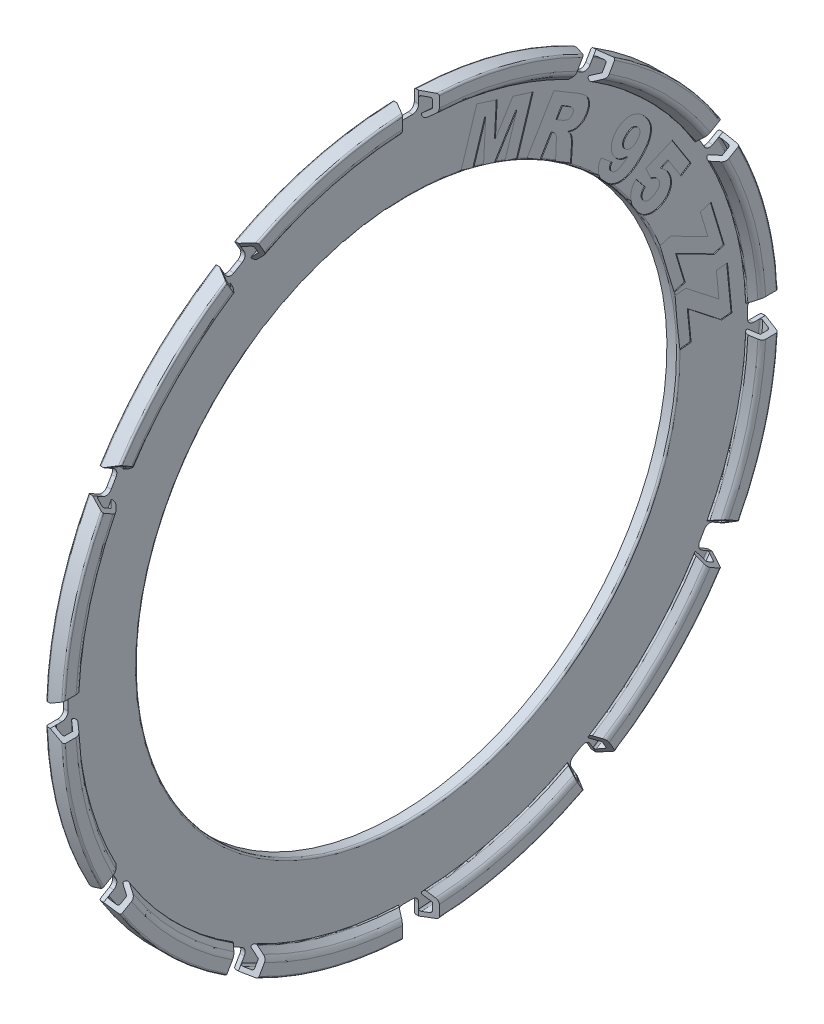
from build123d import *
from OCP.BRepFilletAPI import BRepFilletAPI_MakeFillet

# Parameters (mm, degrees)
FILLET1_R1         = 0.02
FILLET1_R2         = 0.08
SKETCH3_W          = 0.249361734
SKETCH3_H          = 0.345695775
CUT_EXTRUDE2_DEPTH = 6.800215655
CUT_EXTRUDE2_TAPER = -30
CUT_EXTRUDE3_REACH = 7.8
CIRPATTERN2_COUNT  = 12
CUT_EXTRUDE1_DEPTH = 0.01


with BuildPart() as part:
    # Sketch1 → Revolve1 (revolve)
    with BuildSketch(Plane.XY):
        Polygon((1.02, -3.15), (1.1, -3.15), (1.1, -4.1), (1.3, -4.1), (1.3, -3.92), (1.192753778, -3.830009735), (1.160614397, -3.868311957), (1.25, -3.943315383), (1.25, -4.05), (1.15, -4.05), (1.15, -3.1), (1.02, -3.1), align=None)
    revolve(axis=Axis((-6.429017492, 0, 0), (1, 0, 0)))

    # Fillet1: one fillet with a radius per group of edges: ONE call of the kernel's fillet builder (fillet() takes one radius for all edges)
    fillet1_edges_1 = [part.edges().sort_by_distance(p)[0] for p in [
        (1.192753778, 3.830009735, 0),
        (1.160614397, 3.868311957, 0),
        (1.15, 3.1, 0),
        (1.3, 4.1, 0),
        (1.1, 4.1, 0),
        (1.15, 4.05, 0),
        (1.25, 4.05, 0),
    ]]
    fillet1_edges_2 = [part.edges().sort_by_distance(p)[0] for p in [
        (1.3, 3.92, 0),
    ]]
    fillet1 = BRepFilletAPI_MakeFillet(part.part.solid().wrapped)
    for e in fillet1_edges_1:
        fillet1.Add(FILLET1_R1, e.wrapped)
    for e in fillet1_edges_2:
        fillet1.Add(FILLET1_R2, e.wrapped)
    add(Compound.cast(fillet1.Shape()), mode=Mode.REPLACE)

    # Sketch3 → Cut-Extrude2 (cut, through all)
    with BuildSketch(Plane(origin=(1.15, 0, 0), x_dir=(0, 0, -1), z_dir=(1, 0, 0))):
        with Locations((0, 3.957248854)):
            Rectangle(SKETCH3_W, SKETCH3_H)
    cut_extrude2 = extrude(amount=CUT_EXTRUDE2_DEPTH, taper=CUT_EXTRUDE2_TAPER, mode=Mode.SUBTRACT)

    # Cut-Extrude3: up to this face of the body (flat: up to its plane)
    cut_extrude3_end = Plane(part.part.faces().sort_by_distance((1.1, 3.964600173, 0))[0])
    # Sketch4 → Cut-Extrude3 (cut, up to the picked face)
    with BuildSketch(Plane(origin=(1.15, 0, 0), x_dir=(0, 0, -1), z_dir=(1, 0, 0)), mode=Mode.PRIVATE) as cut_extrude3_sk1:
        with BuildLine():
            Line((-0.124680867, 4.098103791), (-0.124680867, 3.96268108))
            ThreePointArc((-0.124680867, 3.96268108), (-0.104178342, 3.913183605), (-0.054680867, 3.89268108))
            Line((-0.054680867, 3.89268108), (0.054680867, 3.89268108))
            ThreePointArc((0.054680867, 3.89268108), (0.104178342, 3.913183605), (0.124680867, 3.96268108))
            Line((0.124680867, 3.96268108), (0.124680867, 4.098103791))
            ThreePointArc((0.124680867, 4.098103791), (0, 4.1), (-0.124680867, 4.098103791))
        make_face()
    cut_extrude3_tool1 = split(extrude(cut_extrude3_sk1.sketch, amount=-CUT_EXTRUDE3_REACH, mode=Mode.PRIVATE), bisect_by=cut_extrude3_end, keep=Keep.BOTH, mode=Mode.PRIVATE)
    cut_extrude3 = cut_extrude3_tool1.solids().sort_by(Axis((1.15, 3.999757, 0), (-1, 0, 0)))[0]
    add(cut_extrude3, mode=Mode.SUBTRACT)

    # CirPattern2: Cut-Extrude2, Cut-Extrude3 ×12 about axis
    cirpattern2_axis = Axis((0, 0, 0), (1, 0, 0))
    add([cut_extrude2.rotate(cirpattern2_axis, i * 360 / CIRPATTERN2_COUNT) for i in range(1, CIRPATTERN2_COUNT)], mode=Mode.SUBTRACT)
    add([cut_extrude3.rotate(cirpattern2_axis, i * 360 / CIRPATTERN2_COUNT) for i in range(1, CIRPATTERN2_COUNT)], mode=Mode.SUBTRACT)

    # Sketch2 → Cut-Extrude1 (cut)
    # profile 1 of 6: a face of its own
    with BuildSketch(Plane(origin=(1.15, 0, 0), x_dir=(0, 0, -1), z_dir=(1, 0, 0))):
        Polygon((3.66364703, 0.615703321), (3.714783394, 0.093747152), (3.595465212, 0.082058841), (3.213403523, 0.382545854), (3.247372679, 0.035670854), (3.11916651, 0.023130269), (3.06364703, 0.58940462), (3.187470082, 0.601579944), (3.565513913, 0.304502022), (3.536171381, 0.60328449), align=None)
    # profile 2 of 6: a face of its own
    with BuildSketch(Plane(origin=(1.15, 0, 0), x_dir=(0, 0, -1), z_dir=(1, 0, 0))):
        Polygon((3.47559593, 1.312338644), (3.626326449, 0.809984748), (3.511513138, 0.775528579), (3.078558592, 0.996754228), (3.178761514, 0.662785073), (3.055303722, 0.625772086), (2.891789112, 1.170983125), (3.01098554, 1.206778579), (3.439191709, 0.987866241), (3.352868657, 1.27544741), align=None)
    # profile 3 of 6: a face of its own
    with BuildSketch(Plane(origin=(1.15, 0, 0), x_dir=(0, 0, -1), z_dir=(1, 0, 0))):
        with BuildLine():
            Line((3.031163029, 2.148398314), (3.245205236, 1.813576886))
            Line((3.245205236, 1.813576886), (3.132705236, 1.74174247))
            Line((3.132705236, 1.74174247), (2.98769712, 1.968568769))
            Line((2.98769712, 1.968568769), (2.903687379, 1.931799288))
            add(Edge.make_bspline(
                [(2.903687379, 1.931799288), (2.912069766, 1.926309982), (2.928453049, 1.915581194), (2.950112021, 1.896569199), (2.969247076, 1.876367556), (2.979634725, 1.861403774), (2.984775042, 1.853998963)],
                knots=[0, 0, 0, 0, 1.060377345, 2.072495912, 3.046176786, 4, 4, 4, 4], degree=3))
            add(Edge.make_bspline(
                [(2.984775042, 1.853998963), (2.988621075, 1.847689699), (2.996125514, 1.835378964), (3.005286821, 1.816202164), (3.012543465, 1.797080971), (3.017728146, 1.777833935), (3.020750576, 1.75856462), (3.021866202, 1.739275058), (3.021044483, 1.719967101), (3.01806756, 1.700811904), (3.013393879, 1.68216046), (3.006897202, 1.664372371), (2.998705192, 1.647593666), (2.988776528, 1.631808789), (2.97717985, 1.617003512), (2.963768224, 1.603330683), (2.948759588, 1.590556141), (2.937693577, 1.583114737), (2.932055886, 1.579323639)],
                knots=[0, 0, 0, 0, 1.129786552, 2.204456955, 3.245771663, 4.254806131, 5.24797659, 6.224334827, 7.206263694, 8.198482794, 9.184798616, 10.143306311, 11.090160968, 12.035875032, 12.99099861, 13.961317358, 14.961372561, 16, 16, 16, 16], degree=3))
            add(Edge.make_bspline(
                [(2.932055886, 1.579323639), (2.927906489, 1.576793564), (2.919664402, 1.571767991), (2.906746828, 1.565192066), (2.893572175, 1.55931849), (2.879906697, 1.554475188), (2.865959135, 1.55026019), (2.851561796, 1.547198763), (2.836868245, 1.544687459), (2.82190401, 1.543136127), (2.806855362, 1.54247911), (2.79200697, 1.543002745), (2.77739474, 1.544438876), (2.763058847, 1.546978325), (2.748948809, 1.55068989), (2.735086961, 1.555391846), (2.721547257, 1.561326853), (2.708176346, 1.568117383), (2.69513981, 1.576223936), (2.682292128, 1.585455532), (2.669888937, 1.596185409), (2.65758001, 1.607977989), (2.64548608, 1.621054947), (2.633729806, 1.635457923), (2.622085477, 1.651058108), (2.614829432, 1.662156075), (2.611114327, 1.667838249)],
                knots=[0, 0, 0, 0, 0.931278742, 1.849830342, 2.77638547, 3.694277949, 4.627212414, 5.567223601, 6.513651321, 7.48360715, 8.449059969, 9.398679697, 10.329145734, 11.261561073, 12.186154544, 13.123489973, 14.06430562, 15.017646431, 15.995680187, 17.00406004, 18.047018188, 19.136438307, 20.270498382, 21.458841581, 22.698923516, 24, 24, 24, 24], degree=3))
            add(Edge.make_bspline(
                [(2.611114327, 1.667838249), (2.606076202, 1.675984689), (2.596367554, 1.691683169), (2.583728537, 1.715212748), (2.573622608, 1.73779228), (2.565527626, 1.759346371), (2.559776614, 1.780132269), (2.556018765, 1.80025312), (2.554423503, 1.819797593), (2.55480705, 1.838757025), (2.556889856, 1.857002654), (2.56042293, 1.874472713), (2.565320602, 1.891129757), (2.571582478, 1.907228118), (2.579696208, 1.92303981), (2.589577492, 1.938935768), (2.601352448, 1.955121868), (2.610269573, 1.965584269), (2.614888678, 1.971003834)],
                knots=[0, 0, 0, 0, 1.389018057, 2.676687394, 3.870186085, 4.974530608, 6.012704509, 6.994041643, 7.938919918, 8.851435123, 9.740001172, 10.59884641, 11.433261006, 12.255230164, 13.100227892, 14.00680079, 14.96751495, 16, 16, 16, 16], degree=3))
            Line((2.614888678, 1.971003834), (2.721666275, 1.838414548))
            add(Edge.make_bspline(
                [(2.721666275, 1.838414548), (2.716905121, 1.833957265), (2.707783583, 1.825417894), (2.696787611, 1.811087325), (2.689031115, 1.796208474), (2.684402734, 1.78104031), (2.683138764, 1.765926778), (2.684410404, 1.751208672), (2.688717892, 1.736988112), (2.693613406, 1.728350476), (2.696098094, 1.723966496)],
                knots=[0, 0, 0, 0, 1.213616079, 2.325075552, 3.346311938, 4.324694772, 5.258381466, 6.154420894, 7.063287553, 8, 8, 8, 8], degree=3))
            add(Edge.make_bspline(
                [(2.696098094, 1.723966496), (2.697712144, 1.72161438), (2.70088969, 1.716983823), (2.706436241, 1.710815105), (2.712263065, 1.705195618), (2.718802718, 1.700595867), (2.725772612, 1.696662175), (2.733251236, 1.693500551), (2.741193573, 1.691027635), (2.749611295, 1.689492825), (2.75842352, 1.688688615), (2.767610107, 1.689145084), (2.77712274, 1.690455947), (2.786909197, 1.692933432), (2.796927026, 1.696548085), (2.807260399, 1.701054799), (2.817935924, 1.706556585), (2.824941734, 1.710889284), (2.828565626, 1.713130457)],
                knots=[0, 0, 0, 0, 0.913152883, 1.797703824, 2.653388644, 3.501528996, 4.351661226, 5.214040415, 6.098495745, 7.011648627, 7.951275192, 8.927451934, 9.951902313, 11.024345986, 12.155507188, 13.361147358, 14.635002052, 16, 16, 16, 16], degree=3))
            add(Edge.make_bspline(
                [(2.828565626, 1.713130457), (2.832209907, 1.715518548), (2.839242943, 1.720127285), (2.848903479, 1.727559774), (2.857333738, 1.735199964), (2.864847399, 1.742734478), (2.870896589, 1.750669028), (2.876173246, 1.758439144), (2.880095152, 1.766522697), (2.883585854, 1.777375192), (2.8858569, 1.791183289), (2.884471684, 1.8078733), (2.879695914, 1.824544128), (2.873773397, 1.83470909), (2.870692249, 1.83999734)],
                knots=[0, 0, 0, 0, 1.031143665, 1.989986348, 2.881133712, 3.723570375, 4.503785587, 5.239184354, 5.943821003, 6.621280475, 7.933781708, 9.224658708, 10.556148287, 12, 12, 12, 12], degree=3))
            add(Edge.make_bspline(
                [(2.870692249, 1.83999734), (2.868372635, 1.843303019), (2.86375795, 1.849879399), (2.855467838, 1.858731573), (2.846063364, 1.866598105), (2.839053647, 1.870924398), (2.835505561, 1.873114223)],
                knots=[0, 0, 0, 0, 0.992778599, 1.975052378, 2.975038902, 4, 4, 4, 4], degree=3))
            add(Edge.make_bspline(
                [(2.835505561, 1.873114223), (2.832535684, 1.874690141), (2.826204548, 1.878049658), (2.815358753, 1.88180012), (2.802907524, 1.885106209), (2.793962817, 1.886660383), (2.789239327, 1.887481106)],
                knots=[0, 0, 0, 0, 0.827442533, 1.763928741, 2.819183258, 4, 4, 4, 4], degree=3))
            Line((2.789239327, 1.887481106), (2.72970199, 2.018731106))
            Line((2.72970199, 2.018731106), (3.031163029, 2.148398314))
        make_face()
    # profile 4 of 6: a face of its own
    with BuildSketch(Plane(origin=(1.15, 0, 0), x_dir=(0, 0, -1), z_dir=(1, 0, 0))):
        with BuildLine():
            Line((2.214078233, 2.382289586), (2.342527908, 2.274781469))
            add(Edge.make_bspline(
                [(2.342527908, 2.274781469), (2.339326783, 2.270269799), (2.333329266, 2.26181689), (2.326616267, 2.248814485), (2.322532963, 2.236645535), (2.321078645, 2.225253049), (2.322025649, 2.214643248), (2.325314111, 2.20484296), (2.329932021, 2.195351569), (2.334638851, 2.189987559), (2.337049012, 2.187240885)],
                knots=[0, 0, 0, 0, 1.371829933, 2.570213281, 3.618308665, 4.541683841, 5.401728159, 6.236444192, 7.096960349, 8, 8, 8, 8], degree=3))
            add(Edge.make_bspline(
                [(2.337049012, 2.187240885), (2.339383674, 2.184938685), (2.34395925, 2.180426728), (2.351741669, 2.174950533), (2.359940314, 2.170514777), (2.368896499, 2.167820317), (2.378285161, 2.166023859), (2.388280912, 2.165768897), (2.398797342, 2.16655418), (2.40585461, 2.168153532), (2.409492194, 2.168977898)],
                knots=[0, 0, 0, 0, 0.997892884, 1.955715893, 2.890899777, 3.826001825, 4.794234963, 5.797024009, 6.86450278, 8, 8, 8, 8], degree=3))
            add(Edge.make_bspline(
                [(2.409492194, 2.168977898), (2.412519232, 2.169887589), (2.419117793, 2.1718706), (2.429372421, 2.176621838), (2.441080571, 2.182671185), (2.454018308, 2.190572184), (2.468469475, 2.199848893), (2.484253032, 2.210777064), (2.501250078, 2.223542899), (2.513030776, 2.232563734), (2.519191869, 2.237281469)],
                knots=[0, 0, 0, 0, 0.583506065, 1.271969484, 2.083837806, 3.019009339, 4.071768496, 5.257717239, 6.565835368, 8, 8, 8, 8], degree=3))
            add(Edge.make_bspline(
                [(2.519191869, 2.237281469), (2.512242753, 2.2376142), (2.498778392, 2.238258887), (2.479248713, 2.241072956), (2.461113997, 2.24544065), (2.44408032, 2.25125881), (2.428122651, 2.259285351), (2.41275413, 2.269166905), (2.397859299, 2.281224622), (2.388742632, 2.290552227), (2.384045765, 2.295357768)],
                knots=[0, 0, 0, 0, 1.100684776, 2.13264782, 3.117285273, 4.049751961, 4.974754887, 5.936926493, 6.937113565, 8, 8, 8, 8], degree=3))
            add(Edge.make_bspline(
                [(2.384045765, 2.295357768), (2.379630041, 2.300298927), (2.370934421, 2.310029253), (2.360018464, 2.326010227), (2.350792607, 2.342495216), (2.343461496, 2.359638376), (2.337892951, 2.377407135), (2.334416863, 2.395879359), (2.332711459, 2.414962537), (2.332863185, 2.434447444), (2.334760211, 2.453986305), (2.338624872, 2.473141746), (2.344584125, 2.491606041), (2.352120518, 2.509519163), (2.361654557, 2.526756719), (2.373277184, 2.543222965), (2.386469554, 2.559271053), (2.396568246, 2.569071013), (2.401699986, 2.57405095)],
                knots=[0, 0, 0, 0, 1.018611076, 2.005889489, 2.970193178, 3.921265689, 4.869258626, 5.829348177, 6.807342006, 7.812661005, 8.822912666, 9.823391597, 10.812741122, 11.803173787, 12.809326263, 13.836494443, 14.900595556, 16, 16, 16, 16], degree=3))
            add(Edge.make_bspline(
                [(2.401699986, 2.57405095), (2.405397979, 2.577339837), (2.412705966, 2.583839349), (2.424222392, 2.592790433), (2.436103174, 2.600799803), (2.448412484, 2.607910081), (2.460990211, 2.614230986), (2.473956377, 2.619646551), (2.487306813, 2.623965297), (2.500855082, 2.627665827), (2.514612597, 2.630324592), (2.528361914, 2.63204001), (2.542031341, 2.632766266), (2.555588801, 2.632570848), (2.569014285, 2.631182974), (2.582322727, 2.628879632), (2.595534843, 2.625544709), (2.608707501, 2.621320412), (2.621789493, 2.615893474), (2.634818265, 2.609448646), (2.647821004, 2.601816643), (2.660746362, 2.593056684), (2.673750474, 2.583317317), (2.686538707, 2.572229214), (2.69940047, 2.560147052), (2.707705861, 2.551444827), (2.711927259, 2.547021729)],
                knots=[0, 0, 0, 0, 1.012817411, 2.001533496, 2.983069013, 3.943423443, 4.90936679, 5.862797577, 6.816409304, 7.779633896, 8.735991707, 9.681901171, 10.613660245, 11.535927468, 12.45429534, 13.373451914, 14.298259823, 15.241392782, 16.202501458, 17.194457931, 18.214607806, 19.286000311, 20.389223433, 21.538075294, 22.748672504, 24, 24, 24, 24], degree=3))
            add(Edge.make_bspline(
                [(2.711927259, 2.547021729), (2.716855801, 2.541593158), (2.726480425, 2.530992061), (2.739581136, 2.514643353), (2.75140138, 2.49855006), (2.761597743, 2.48249367), (2.770393807, 2.466646206), (2.777855096, 2.451009733), (2.783482352, 2.435386255), (2.788035251, 2.419925596), (2.790871519, 2.404371229), (2.792670153, 2.388626977), (2.792944362, 2.372621627), (2.79217029, 2.356285378), (2.789758652, 2.339778662), (2.786216103, 2.322931224), (2.78131292, 2.305868643), (2.775257838, 2.288438547), (2.767493523, 2.270894185), (2.758274851, 2.253041101), (2.747091267, 2.235199715), (2.73437496, 2.217111444), (2.719998188, 2.198852227), (2.703832977, 2.180474622), (2.686099862, 2.161809121), (2.673308628, 2.149722422), (2.666756804, 2.143531469)],
                knots=[0, 0, 0, 0, 1.132441812, 2.211470925, 3.234782169, 4.215730974, 5.147438288, 6.033740527, 6.888640632, 7.710222934, 8.520556587, 9.32785277, 10.155655207, 10.990667676, 11.851615706, 12.729585213, 13.648484433, 14.592347335, 15.577793865, 16.609749838, 17.69368572, 18.827775099, 20.024335027, 21.281779053, 22.607694439, 24, 24, 24, 24], degree=3))
            add(Edge.make_bspline(
                [(2.666756804, 2.143531469), (2.657007305, 2.134713855), (2.638181351, 2.117687338), (2.609027044, 2.095124213), (2.580604722, 2.07570196), (2.552520372, 2.05992576), (2.525019043, 2.047442668), (2.498010169, 2.038453912), (2.471502772, 2.032829062), (2.445517493, 2.03074337), (2.420143698, 2.031894847), (2.395356598, 2.035820894), (2.371125871, 2.042487298), (2.347647982, 2.052293582), (2.324685592, 2.064621417), (2.30250987, 2.080063564), (2.280707015, 2.098026883), (2.267317174, 2.111859706), (2.26046622, 2.118937313)],
                knots=[0, 0, 0, 0, 1.357581942, 2.621445132, 3.805238318, 4.910875553, 5.944914316, 6.920738571, 7.845802903, 8.737505203, 9.606210831, 10.463694268, 11.325278197, 12.195752621, 13.086833728, 14.012543923, 14.983111915, 16, 16, 16, 16], degree=3))
            add(Edge.make_bspline(
                [(2.26046622, 2.118937313), (2.256548624, 2.123260955), (2.248939081, 2.131659203), (2.238173743, 2.144245173), (2.228361634, 2.156447341), (2.219946734, 2.168599328), (2.212162456, 2.180091404), (2.205570957, 2.191372408), (2.199926112, 2.20227577), (2.194002133, 2.21631604), (2.188350379, 2.233705267), (2.184390345, 2.25473861), (2.182671738, 2.275778198), (2.183857174, 2.296880609), (2.187548085, 2.318125703), (2.1939137, 2.339494198), (2.202471367, 2.361210608), (2.21014317, 2.375143204), (2.214078233, 2.382289586)],
                knots=[0, 0, 0, 0, 0.960958594, 1.86656712, 2.727866422, 3.538380214, 4.300386233, 5.013498818, 5.689157579, 6.321143125, 7.521912313, 8.692664823, 9.839060349, 10.990415072, 12.164140975, 13.382642286, 14.657490914, 16, 16, 16, 16], degree=3))
        make_face()
        with BuildLine():
            add(Edge.make_bspline(
                [(2.620125311, 2.339554196), (2.622968799, 2.342313285), (2.628517904, 2.347697683), (2.635904981, 2.356252994), (2.642478176, 2.364806252), (2.647930603, 2.37353535), (2.652408071, 2.382411588), (2.655773338, 2.391404298), (2.65831572, 2.400475934), (2.659552395, 2.40960539), (2.660126901, 2.418612004), (2.659576048, 2.427336304), (2.658385071, 2.4357429), (2.656342814, 2.443816), (2.65326466, 2.451527094), (2.649274072, 2.458838578), (2.644753146, 2.466013943), (2.640930264, 2.470246579), (2.638997064, 2.472386989)],
                knots=[0, 0, 0, 0, 1.264846107, 2.468363641, 3.606443199, 4.70699658, 5.750421255, 6.775980529, 7.769587187, 8.752141148, 9.712732923, 10.647439442, 11.538338591, 12.421757028, 13.300312312, 14.181731524, 15.080516552, 16, 16, 16, 16], degree=3))
            add(Edge.make_bspline(
                [(2.638997064, 2.472386989), (2.635174302, 2.476115238), (2.627682342, 2.48342197), (2.613897055, 2.49090319), (2.598912458, 2.495288384), (2.585621776, 2.496097485), (2.57462566, 2.49523177), (2.566120973, 2.493277368), (2.5574695, 2.490547632), (2.548783712, 2.486495859), (2.539873856, 2.481701944), (2.531010586, 2.475617057), (2.521925669, 2.468694134), (2.516109851, 2.463422885), (2.513104207, 2.460698677)],
                knots=[0, 0, 0, 0, 1.344068177, 2.634143829, 3.916203463, 5.262969122, 5.973336604, 6.697563001, 7.463028836, 8.261783884, 9.115539344, 10.017293101, 10.975327121, 12, 12, 12, 12], degree=3))
            add(Edge.make_bspline(
                [(2.513104207, 2.460698677), (2.510149038, 2.457850446), (2.504441619, 2.45234956), (2.496666718, 2.443793875), (2.490100782, 2.435109761), (2.48445162, 2.42645895), (2.479803633, 2.417784533), (2.476064444, 2.40909838), (2.473505837, 2.400344786), (2.472073196, 2.391630533), (2.471458888, 2.383113356), (2.471628355, 2.374813701), (2.472940748, 2.366835866), (2.474827266, 2.359137642), (2.477654577, 2.351778043), (2.481372233, 2.344778549), (2.485881494, 2.338024693), (2.48947772, 2.333876122), (2.491310376, 2.331761989)],
                knots=[0, 0, 0, 0, 1.3409604, 2.589843021, 3.772772823, 4.894661599, 5.962582988, 6.984731665, 7.97932503, 8.934226749, 9.864878957, 10.76703356, 11.639155778, 12.501136695, 13.353268423, 14.20746143, 15.086512933, 16, 16, 16, 16], degree=3))
            add(Edge.make_bspline(
                [(2.491310376, 2.331761989), (2.493332349, 2.329679421), (2.49726879, 2.325625013), (2.503911825, 2.320512855), (2.510635485, 2.315898024), (2.517949949, 2.312429715), (2.525483203, 2.309504907), (2.533469031, 2.307837503), (2.541666528, 2.306460512), (2.550206656, 2.306338257), (2.558921141, 2.306821856), (2.567655718, 2.308685258), (2.576475876, 2.311154376), (2.585239914, 2.314908122), (2.594080509, 2.319522928), (2.602773163, 2.325336415), (2.61165867, 2.331881848), (2.617246207, 2.336945194), (2.620125311, 2.339554196)],
                knots=[0, 0, 0, 0, 0.957774174, 1.864625435, 2.764709055, 3.646321763, 4.533120772, 5.427693113, 6.336129433, 7.275226948, 8.243087165, 9.213545172, 10.219310648, 11.265306743, 12.357065566, 13.510109389, 14.71702796, 16, 16, 16, 16], degree=3))
        make_face(mode=Mode.SUBTRACT)
    # profile 5 of 6: a face of its own
    with BuildSketch(Plane(origin=(1.15, 0, 0), x_dir=(0, 0, -1), z_dir=(1, 0, 0))):
        with BuildLine():
            Line((1.364475002, 2.800386228), (1.673850002, 3.319176812))
            Line((1.673850002, 3.319176812), (1.941098379, 3.159801812))
            add(Edge.make_bspline(
                [(1.941098379, 3.159801812), (1.94708257, 3.1561789), (1.958690734, 3.149151154), (1.975266606, 3.138447092), (1.990463553, 3.127917766), (2.004538984, 3.117927354), (2.017088578, 3.107911591), (2.028269438, 3.098128756), (2.03837018, 3.088851302), (2.046974171, 3.079469883), (2.054508252, 3.070055624), (2.061290789, 3.060525911), (2.066861465, 3.050366082), (2.071808236, 3.039964182), (2.075611829, 3.02902746), (2.078924471, 3.01785644), (2.080857632, 3.006157011), (2.082273103, 2.994214756), (2.08260568, 2.982036634), (2.082024281, 2.969776024), (2.080310323, 2.957470485), (2.077465186, 2.945151496), (2.073672112, 2.932826749), (2.068922367, 2.920476476), (2.063026478, 2.908143854), (2.058475776, 2.900076422), (2.056155197, 2.895962527)],
                knots=[0, 0, 0, 0, 1.52421648, 2.956683234, 4.298411992, 5.552568854, 6.71680078, 7.794929175, 8.78964583, 9.70335276, 10.565131657, 11.416365308, 12.2478012, 13.086541207, 13.922900349, 14.76832661, 15.621762206, 16.502612791, 17.38731677, 18.272727594, 19.174416357, 20.090431171, 21.024703841, 21.982126044, 22.971008072, 24, 24, 24, 24], degree=3))
            add(Edge.make_bspline(
                [(2.056155197, 2.895962527), (2.051777894, 2.88910389), (2.043294027, 2.875810825), (2.028102753, 2.858360162), (2.011615895, 2.843637043), (1.993557192, 2.832077864), (1.974494886, 2.823110497), (1.954579591, 2.816645329), (1.933789241, 2.812628996), (1.919646935, 2.812018425), (1.912486366, 2.81170928)],
                knots=[0, 0, 0, 0, 1.116964893, 2.16484507, 3.168642299, 4.144910606, 5.100565266, 6.05661052, 7.016018052, 8, 8, 8, 8], degree=3))
            add(Edge.make_bspline(
                [(1.912486366, 2.81170928), (1.907567373, 2.811853074), (1.897107155, 2.812158851), (1.880698827, 2.814788637), (1.862738738, 2.818966006), (1.850411198, 2.822750194), (1.843939288, 2.824736877)],
                knots=[0, 0, 0, 0, 0.842387808, 1.791333954, 2.840458994, 4, 4, 4, 4], degree=3))
            add(Edge.make_bspline(
                [(1.843939288, 2.824736877), (1.847470186, 2.820548754), (1.854104154, 2.812679967), (1.862792319, 2.801175394), (1.86951749, 2.790741158), (1.872772837, 2.783900357), (1.874255846, 2.780783955)],
                knots=[0, 0, 0, 0, 1.226638082, 2.304648429, 3.227664101, 4, 4, 4, 4], degree=3))
            add(Edge.make_bspline(
                [(1.874255846, 2.780783955), (1.875161577, 2.778446714), (1.877231827, 2.773104424), (1.879336737, 2.763533893), (1.881670752, 2.751693921), (1.883681417, 2.738152606), (1.885436598, 2.724473767), (1.88671057, 2.712097577), (1.887281237, 2.701688975), (1.887114571, 2.695435112), (1.887039937, 2.692634605)],
                knots=[0, 0, 0, 0, 0.671639625, 1.53518329, 2.622103418, 3.911019199, 5.206174517, 6.322102933, 7.248630304, 8, 8, 8, 8], degree=3))
            Line((1.887039937, 2.692634605), (1.874742859, 2.496124864))
            Line((1.874742859, 2.496124864), (1.693574028, 2.604119994))
            Line((1.693574028, 2.604119994), (1.702462015, 2.813657332))
            add(Edge.make_bspline(
                [(1.702462015, 2.813657332), (1.702727178, 2.819908961), (1.703216341, 2.831441775), (1.702446474, 2.847256051), (1.701005356, 2.860279509), (1.698473181, 2.867620472), (1.697348379, 2.870881358)],
                knots=[0, 0, 0, 0, 1.297206785, 2.39304758, 3.286185036, 4, 4, 4, 4], degree=3))
            add(Edge.make_bspline(
                [(1.697348379, 2.870881358), (1.695510353, 2.874479558), (1.691851978, 2.881641351), (1.684399185, 2.891188099), (1.675542723, 2.899633678), (1.66869218, 2.904139844), (1.665205522, 2.906433306)],
                knots=[0, 0, 0, 0, 0.994984069, 1.98039857, 2.972101935, 4, 4, 4, 4], degree=3))
            Line((1.665205522, 2.906433306), (1.651082145, 2.91483428))
            Line((1.651082145, 2.91483428), (1.525554548, 2.704322916))
            Line((1.525554548, 2.704322916), (1.364475002, 2.800386228))
        make_face()
        with BuildLine():
            Line((1.709523704, 3.012845644), (1.777096756, 2.972545319))
            add(Edge.make_bspline(
                [(1.777096756, 2.972545319), (1.779429515, 2.97128239), (1.784966509, 2.968284725), (1.795289461, 2.964378508), (1.808435592, 2.959284263), (1.818391371, 2.956053642), (1.823850002, 2.954282332)],
                knots=[0, 0, 0, 0, 0.632740048, 1.50186006, 2.63030038, 4, 4, 4, 4], degree=3))
            add(Edge.make_bspline(
                [(1.823850002, 2.954282332), (1.826788151, 2.95339234), (1.832576377, 2.951639033), (1.841696802, 2.95108479), (1.850759801, 2.952209537), (1.859667395, 2.954939604), (1.868101305, 2.958977039), (1.875689147, 2.964490232), (1.882333293, 2.97116651), (1.885787141, 2.976455677), (1.88752695, 2.979119994)],
                knots=[0, 0, 0, 0, 0.992952948, 1.956142404, 2.937421923, 3.941049758, 4.965440086, 5.955509458, 6.970126873, 8, 8, 8, 8], degree=3))
            add(Edge.make_bspline(
                [(1.88752695, 2.979119994), (1.889739851, 2.98318131), (1.893965566, 2.990936728), (1.897173474, 3.003401471), (1.897659328, 3.01557332), (1.895447827, 3.025463912), (1.89210891, 3.033168852), (1.88834128, 3.039056709), (1.883504924, 3.045071413), (1.877608298, 3.051196985), (1.870496168, 3.057339842), (1.862347309, 3.063667253), (1.853019646, 3.070060952), (1.846312819, 3.074159162), (1.842843509, 3.076279085)],
                knots=[0, 0, 0, 0, 1.352480355, 2.582672843, 3.738114794, 4.896497429, 5.520289661, 6.194220053, 6.939848696, 7.781904032, 8.684648722, 9.694421872, 10.807369706, 12, 12, 12, 12], degree=3))
            Line((1.842843509, 3.076279085), (1.772470132, 3.118283955))
            Line((1.772470132, 3.118283955), (1.709523704, 3.012845644))
        make_face(mode=Mode.SUBTRACT)
    # profile 6 of 6: a face of its own
    with BuildSketch(Plane(origin=(1.15, 0, 0), x_dir=(0, 0, -1), z_dir=(1, 0, 0))):
        Polygon((0.790894621, 3.628466214), (1.024417349, 3.5548055), (1.004328063, 3.176883422), (1.204368647, 3.498068487), (1.437039102, 3.424651279), (1.255870271, 2.850097708), (1.110983907, 2.895876929), (1.249173842, 3.334066864), (0.998483907, 2.931307123), (0.867112154, 2.972703227), (0.893289102, 3.446201604), (0.755099167, 3.008011669), (0.60972579, 3.053912643), align=None)
    extrude(amount=-CUT_EXTRUDE1_DEPTH, mode=Mode.SUBTRACT)


solid = part.part
